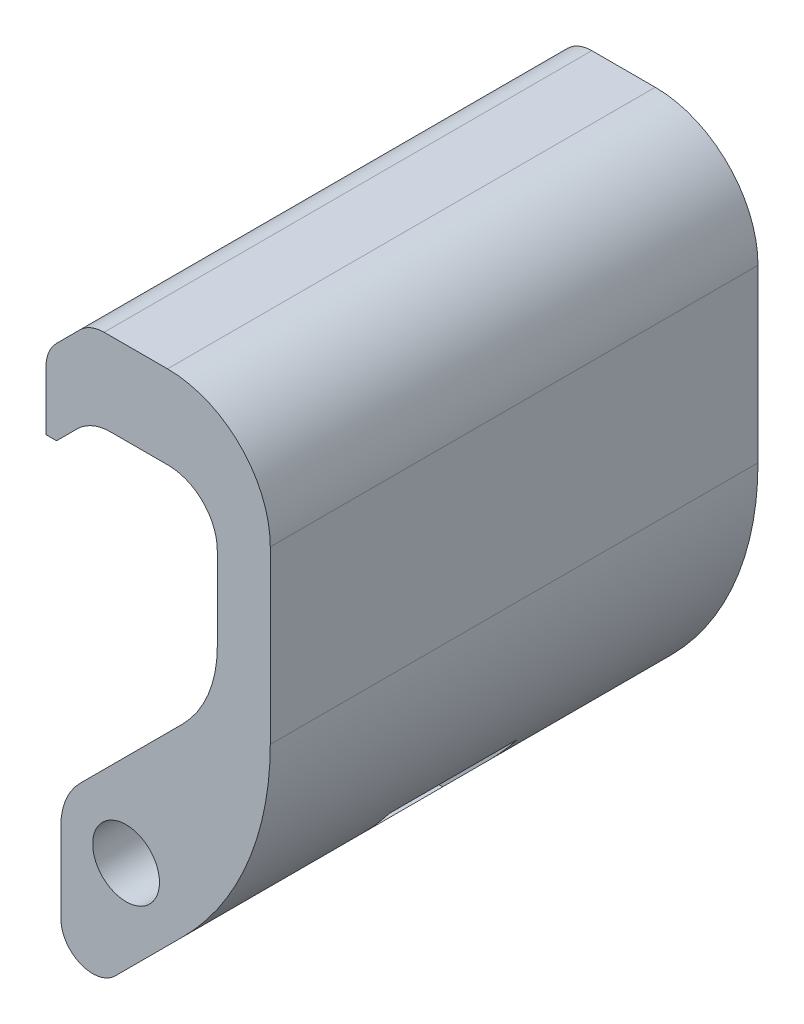
from build123d import *

# Parameters (mm, degrees)
SKETCH1_R           = 1.575
BOSS_EXTRUDE1_DEPTH = 11.5
SKETCH2_R           = 3.928649494
CUT_EXTRUDE1_DEPTH  = 3


with BuildPart() as part:
    # Sketch1 → Boss-Extrude1 (new, symmetric)
    with BuildSketch(Plane.XY):
        with BuildLine():
            ThreePointArc((-3.276821683, 19.593103038), (-3.646875917, 19.03927774), (-3.776821683, 18.385996257))
            Line((-3.776821683, 18.385996257), (-3.776821683, 15.612634843))
            Line((-3.776821683, 15.612634843), (-3.276821683, 15.612634843))
            Line((-3.276821683, 15.612634843), (-2.29498552, 16.594471006))
            ThreePointArc((-2.29498552, 16.594471006), (-1.572478653, 17.07723466), (-0.720223694, 17.246758712))
            Line((-0.720223694, 17.246758712), (1.97953608, 17.246758712))
            ThreePointArc((1.97953608, 17.246758712), (3.620351853, 16.567110565), (4.3, 14.926294792))
            Line((4.3, 14.926294792), (4.3, 10.980330086))
            ThreePointArc((4.3, 10.980330086), (3.871515088, 8.826190966), (2.651293296, 7))
            Line((2.651293296, 7), (-2.174353352, 2.174353352))
            ThreePointArc((-2.174353352, 2.174353352), (-2.840929562, 1.176751555), (-3.075, 0))
            Line((-3.075, 0), (-3.075, -3.802386361))
            ThreePointArc((-3.075, -3.802386361), (-2.149025149, -5.18820566), (-0.514339828, -4.863046533))
            Line((-0.514339828, -4.863046533), (2.699494937, -1.649211768))
            ThreePointArc((2.699494937, -1.649211768), (5.734313455, 2.892715116), (6.8, 8.250283169))
            Line((6.8, 8.250283169), (6.8, 16.318707015))
            ThreePointArc((6.8, 16.318707015), (5.380486719, 19.745715229), (1.953478506, 21.16522851))
            Line((1.953478506, 21.16522851), (-1.035695437, 21.16522851))
            ThreePointArc((-1.035695437, 21.16522851), (-1.65377156, 21.042285525), (-2.177751196, 20.692173525))
            Line((-2.177751196, 20.692173525), (-3.276821683, 19.593103038))
        make_face()
        Circle(SKETCH1_R, mode=Mode.SUBTRACT)
    extrude(amount=BOSS_EXTRUDE1_DEPTH, both=True)

    # Sketch2 → Cut-Extrude1 (cut, symmetric)
    with BuildSketch(Plane.XY):
        Circle(SKETCH2_R)
    extrude(amount=CUT_EXTRUDE1_DEPTH, both=True, mode=Mode.SUBTRACT)


solid = part.part
